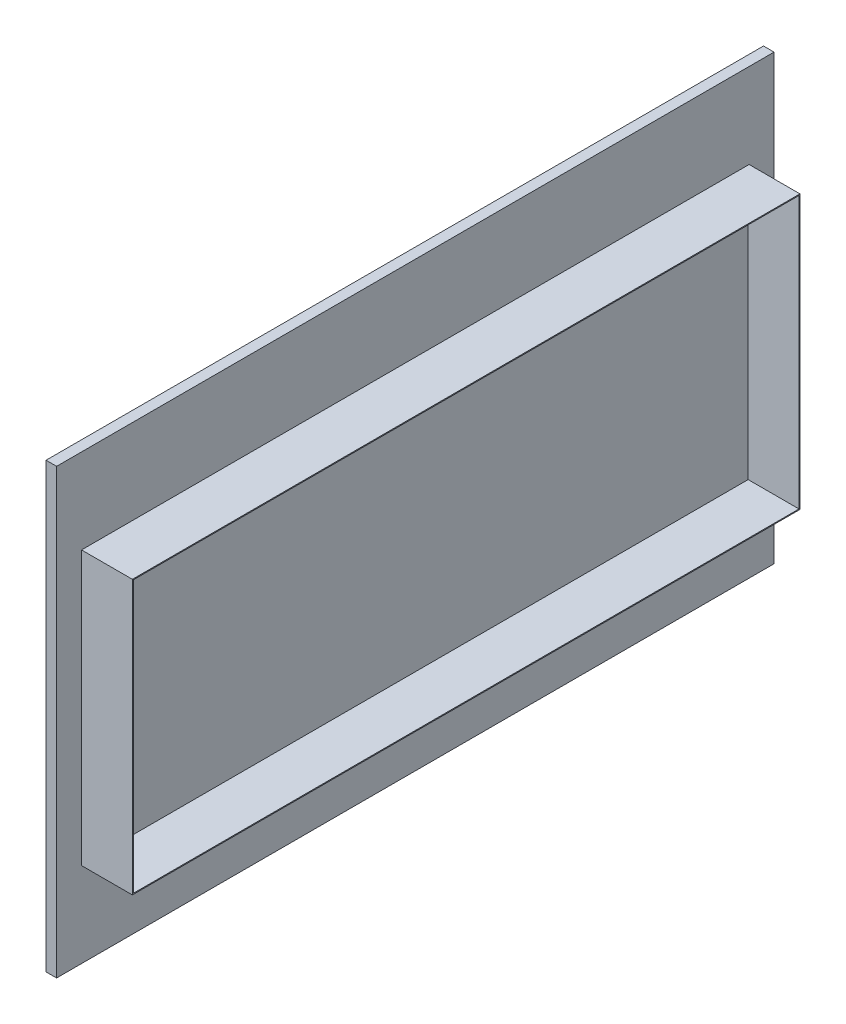
from build123d import *

# Parameters (mm, degrees)
SKETCH1_W                 = 189.992
SKETCH1_H                 = 117.348
BOSS_EXTRUDE1_DEPTH       = 2.794
EXTRUDE_THIN4_OUTLINE_W   = 176.784
EXTRUDE_THIN4_OUTLINE_H   = 72.39
EXTRUDE_THIN4_OUTLINE_W_2 = 176.276
EXTRUDE_THIN4_OUTLINE_H_2 = 71.882
EXTRUDE_THIN4_DEPTH       = 13.462


# Read off the part's stored shape, not the designer's step: Extrude-Thin4
with BuildPart() as part:
    # Sketch1 → Boss-Extrude1 (new body)
    with BuildSketch(Plane(origin=(0, 0, 0), x_dir=(0, 0, -1), z_dir=(1, 0, 0))):
        with Locations((-94.996, -58.674)):
            Rectangle(SKETCH1_W, SKETCH1_H)
    extrude(amount=BOSS_EXTRUDE1_DEPTH)

    # Extrude-Thin4 outline → Extrude-Thin4 (add)
    with BuildSketch(Plane(origin=(2.794, 0, 0), x_dir=(0, 0, -1), z_dir=(1, 0, 0))):
        with Locations((-94.996, -58.674)):
            Rectangle(EXTRUDE_THIN4_OUTLINE_W, EXTRUDE_THIN4_OUTLINE_H)
        with Locations((-94.996, -58.674)):
            Rectangle(EXTRUDE_THIN4_OUTLINE_W_2, EXTRUDE_THIN4_OUTLINE_H_2, mode=Mode.SUBTRACT)
    extrude(amount=EXTRUDE_THIN4_DEPTH)


solid = part.part
